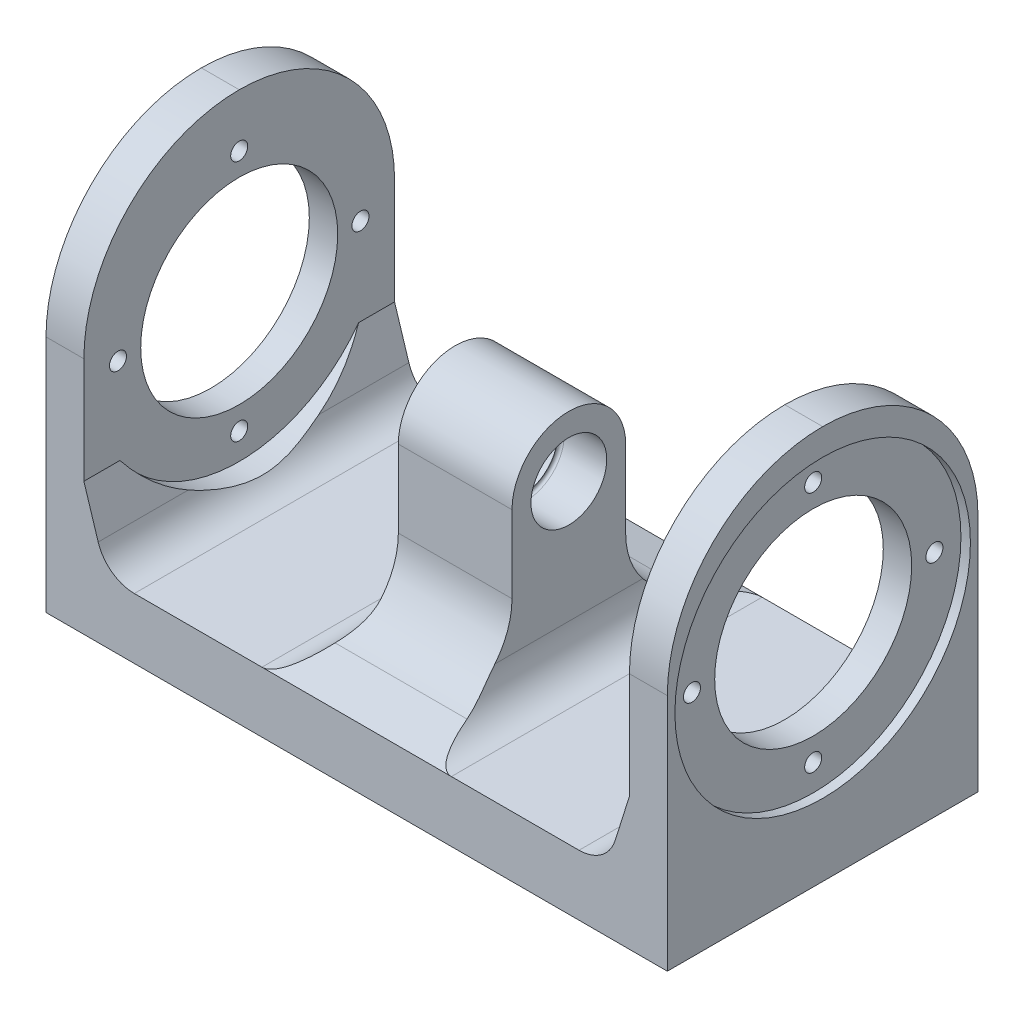
from build123d import *

# Parameters (mm, degrees)
BOSS_EXTRUDE1_DEPTH      = 82
SKETCH5_R                = 10
CUT_EXTRUDE1_DEPTH       = 12
CUT_EXTRUDE2_REACH       = 156.211
SKETCH6_R                = 9
CUT_EXTRUDE4_REACH       = 152.745
SKETCH8_R                = 26
CUT_EXTRUDE5_REACH       = 157.769
FILLET3_R                = 41
SKETCH13_R               = 39
CUT_EXTRUDE6_DEPTH       = 2.5
M4_CLEARANCE_HOLE1_D     = 4.5
M4_CLEARANCE_HOLE1_DEPTH = 7.5
FILLET5_R                = 0.8
CHAMFER2_SIZE            = 5
BOSS_EXTRUDE3_START      = -82
BOSS_EXTRUDE3_DEPTH      = 82
SKETCH19_R               = 39
CUT_EXTRUDE7_DEPTH       = 20
FILLET6_START            = -82.0000001
FILLET6_DEPTH            = 82.0000001
FILLET6_START_2          = -26
FILLET6_2_DEPTH          = 52


with BuildPart() as part:
    # Sketch1 → Boss-Extrude1 (new body)
    with BuildSketch(Plane.XY):
        Polygon((0, 0), (-72, 0), (-82, 0), (-82, 104), (-72, 104), (-72, 10), (-15, 10), (-15, 74), (0, 74), align=None)
    extrude(amount=-BOSS_EXTRUDE1_DEPTH)

    # Sketch5 → Cut-Extrude1 (cut)
    with BuildSketch(Plane.ZY.offset(15)):
        with Locations(Location((-41, 58, 0), (0, 0, 270))):
            Circle(SKETCH5_R)
    extrude(amount=-CUT_EXTRUDE1_DEPTH, mode=Mode.SUBTRACT)

    # Sketch6 → Cut-Extrude2 (cut, up to next)
    with BuildSketch(Plane.ZY.offset(3), mode=Mode.PRIVATE) as cut_extrude2_sk1:
        with Locations(Location((-41, 58, 0), (0, 0, 270))):
            Circle(SKETCH6_R)
    cut_extrude2_tool1 = extrude(cut_extrude2_sk1.sketch, amount=-CUT_EXTRUDE2_REACH, mode=Mode.PRIVATE) & part.part
    add(cut_extrude2_tool1.solids().sort_by_distance((-3, 58, -41))[0], mode=Mode.SUBTRACT)

    # Sketch8 → Cut-Extrude4 (cut, up to next)
    with BuildSketch(Plane(origin=(-72, 0, 0), x_dir=(0, 0, -1), z_dir=(1, 0, 0)), mode=Mode.PRIVATE) as cut_extrude4_sk1:
        with Locations(Location((41, 58, 0), (0, 0, 90))):
            Circle(SKETCH8_R)
    cut_extrude4_tool1 = extrude(cut_extrude4_sk1.sketch, amount=-CUT_EXTRUDE4_REACH, mode=Mode.PRIVATE) & part.part
    add(cut_extrude4_tool1.solids().sort_by_distance((-72, 58, -41))[0], mode=Mode.SUBTRACT)

    # Sketch10 → Cut-Extrude5 (cut, up to next)
    with BuildSketch(Plane(origin=(0, 0, 0), x_dir=(0, 0, -1), z_dir=(1, 0, 0)), mode=Mode.PRIVATE) as cut_extrude5_sk1:
        with BuildLine():
            Line((0, 74), (0, 16))
            Line((0, 16), (11.714285714, 19.492525222))
            ThreePointArc((11.714285714, 19.492525222), (22.035674515, 26.706536079), (26, 38.658822172))
            Line((26, 38.658822172), (26, 59))
            ThreePointArc((26, 59), (30.393398282, 69.606601718), (41, 74))
            Line((41, 74), (0, 74))
        make_face()
    cut_extrude5_tool1 = extrude(cut_extrude5_sk1.sketch, amount=-CUT_EXTRUDE5_REACH, mode=Mode.PRIVATE) & part.part
    # Sketch10 → Cut-Extrude5 (cut, up to next)
    with BuildSketch(Plane(origin=(0, 0, 0), x_dir=(0, 0, -1), z_dir=(1, 0, 0)), mode=Mode.PRIVATE) as cut_extrude5_sk2:
        with BuildLine():
            Line((82, 74), (41, 74))
            ThreePointArc((41, 74), (51.606601718, 69.606601718), (56, 59))
            Line((56, 59), (56, 38.658822172))
            ThreePointArc((56, 38.658822172), (59.964325485, 26.706536079), (70.285714286, 19.492525222))
            Line((70.285714286, 19.492525222), (82, 16))
            Line((82, 16), (82, 74))
        make_face()
    cut_extrude5_tool2 = extrude(cut_extrude5_sk2.sketch, amount=-CUT_EXTRUDE5_REACH, mode=Mode.PRIVATE) & part.part
    add(cut_extrude5_tool1.solids().sort_by_distance((0, 48.321716, -12.955067))[0], mode=Mode.SUBTRACT)
    add(cut_extrude5_tool2.solids().sort_by_distance((0, 48.321716, -69.044933))[0], mode=Mode.SUBTRACT)

    # Fillet3
    fillet3_edges = [part.edges().sort_by_distance(p)[0] for p in [
        (-77, 104, -82),
        (-77, 104, 0),
    ]]
    fillet(fillet3_edges, radius=FILLET3_R - 0.0001)  # a hair under: the kernel refuses the full size

    # Sketch13 → Cut-Extrude6 (cut)
    with BuildSketch(Plane.ZY.offset(82)):
        with Locations((-41, 58)):
            Circle(SKETCH13_R)
    extrude(amount=-CUT_EXTRUDE6_DEPTH, mode=Mode.SUBTRACT)

    # M4 Clearance Hole1
    with Locations(Plane.ZY.offset(79.5)):
        with Locations((-41, 90), (-9, 58), (-41, 26), (-73, 58)):
            Hole(M4_CLEARANCE_HOLE1_D / 2, depth=M4_CLEARANCE_HOLE1_DEPTH)

    # Fillet5
    fillet5_edges = [part.edges().sort_by_distance(p)[0] for p in [
        (-3, 68, -41),
    ]]
    fillet(fillet5_edges, radius=FILLET5_R)

    # Mirror1: part across plane


with BuildPart() as part_1:
    add(part.part)
    add(part.part.mirror(Plane(origin=(0, 74, -82), x_dir=(0, 0, 1), z_dir=(1, 0, 0))))

    # Chamfer2
    chamfer2_edges = [part_1.edges().sort_by_distance(p)[0] for p in [
        (72, 10, -41),
        (-72, 10, -41),
    ]]
    chamfer(chamfer2_edges, length=CHAMFER2_SIZE)

    # Sketch18 → Boss-Extrude3 (add)
    with BuildSketch(Plane.XY.offset(BOSS_EXTRUDE3_START)):
        with BuildLine():
            Line((-72, 35), (-68.226174588, 23))
            ThreePointArc((-68.226174588, 23), (-64.602862357, 17.937742252), (-58.686782574, 16))
            Line((-58.686782574, 16), (0, 16))
            Line((0, 16), (0, 10))
            Line((0, 10), (-67, 10))
            Line((-67, 10), (-72, 15))
            Line((-72, 15), (-72, 35))
        make_face()
    boss_extrude3 = extrude(amount=BOSS_EXTRUDE3_DEPTH)

    # Mirror2: Boss-Extrude3 across plane
    add(boss_extrude3.mirror(Plane(origin=(0, 0, 0), x_dir=(0, 0, 1), z_dir=(1, 0, 0))))

    # Sketch19 → Cut-Extrude7 (cut)
    with BuildSketch(Plane(origin=(-72, 0, 0), x_dir=(0, 0, -1), z_dir=(1, 0, 0))):
        with Locations(Location((41, 58, 0), (0, 0, 180))):
            Circle(SKETCH19_R)
    cut_extrude7 = extrude(amount=CUT_EXTRUDE7_DEPTH, mode=Mode.SUBTRACT)

    # Mirror3: Cut-Extrude7 across plane
    add(cut_extrude7.mirror(Plane(origin=(0, 0, 0), x_dir=(0, 0, 1), z_dir=(1, 0, 0))), mode=Mode.SUBTRACT)

    # Fillet6: read off the stored shape, not the designer's step
    # Fillet6 outline → Fillet6 (add)
    with BuildSketch(Plane.XY.offset(FILLET6_START)):
        with BuildLine():
            Line((15, 16), (25, 16))
            ThreePointArc((25, 16), (17.928932188, 18.928932188), (15, 26))
            Line((15, 26), (15, 16))
        make_face()
        with BuildLine():
            ThreePointArc((-15, 26), (-17.928932188, 18.928932188), (-25, 16))
            Line((-25, 16), (-15, 16))
            Line((-15, 16), (-15, 26))
        make_face()
    extrude(amount=FILLET6_DEPTH)

    # Fillet6 2 outline → Fillet6 2 (cut)
    with BuildSketch(Plane.YZ.offset(FILLET6_START_2)):
        with BuildLine():
            Line((19.492525222, -70.285714286), (16, -82))
            Line((16, -82), (26, -82.0000001))
            Line((26, -82.0000001), (26, -60.516001123))
            ThreePointArc((26, -60.516001123), (22.013361061, -64.912681821), (19.492525222, -70.285714286))
        make_face()
        with BuildLine():
            Line((26, 0), (16, 0))
            Line((16, 0), (19.492525222, -11.714285714))
            ThreePointArc((19.492525222, -11.714285714), (22.013361061, -17.087318179), (26, -21.483998877))
            Line((26, -21.483998877), (26, 0))
        make_face()
    extrude(amount=FILLET6_2_DEPTH, mode=Mode.SUBTRACT)


solid = part_1.part
